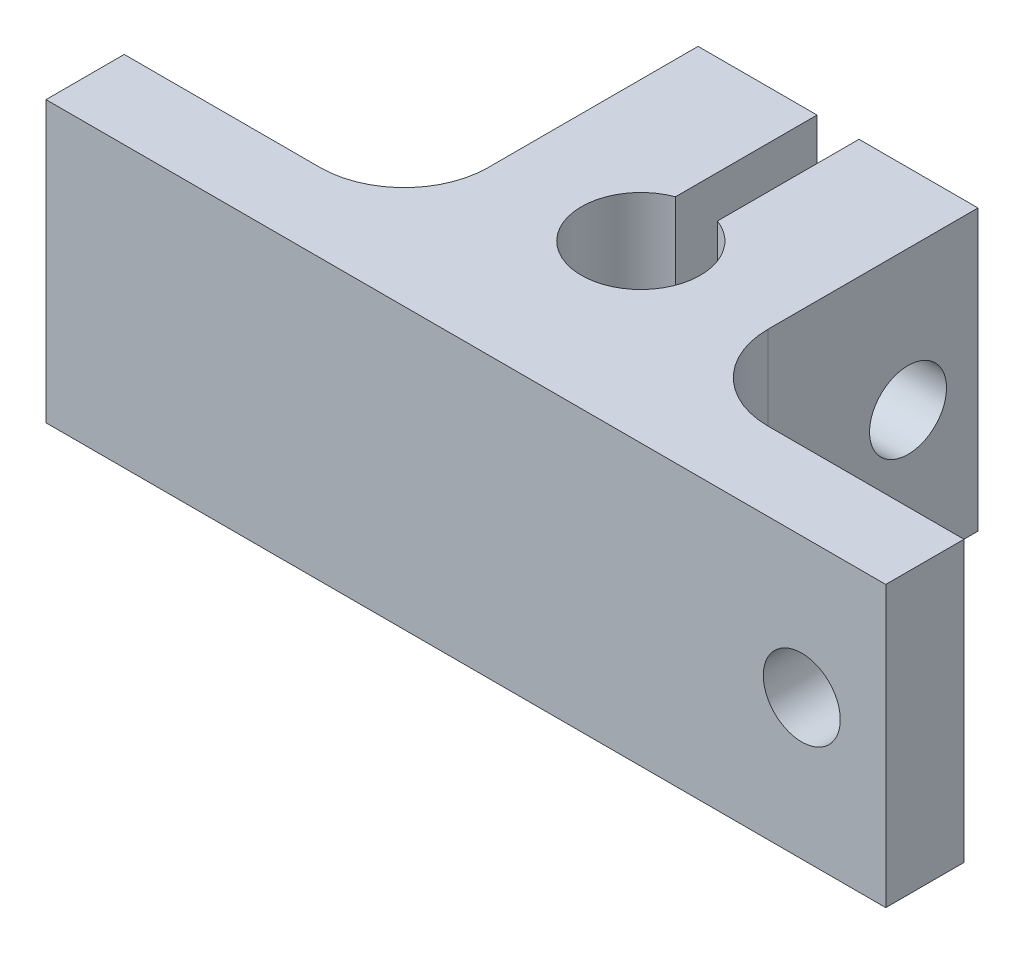
from build123d import *

# Parameters (mm, degrees)
BOSS_EXTRUDE1_DEPTH = 20
SKETCH2_R           = 2.75
CUT_EXTRUDE1_DEPTH  = 42.72529209
SKETCH3_R           = 2.75
CUT_EXTRUDE2_DEPTH  = 47.888574156


with BuildPart() as part:
    # Sketch1 → Boss-Extrude1 (new body)
    with BuildSketch(Plane(origin=(0, 0, 0), x_dir=(1, 0, 0), z_dir=(0, 1, 0))):
        with BuildLine():
            Line((30, -12.5), (-30, -12.5))
            Line((-30, -12.5), (-30, -6.90963498))
            Line((-30, -6.90963498), (-16, -6.90963498))
            ThreePointArc((-16, -6.90963498), (-11.757359313, -5.152275667), (-10, -0.90963498))
            Line((-10, -0.90963498), (-10, 14.09036502))
            Line((-10, 14.09036502), (-1.5, 14.09036502))
            Line((-1.5, 14.09036502), (-1.5, 3.97649343))
            ThreePointArc((-1.5, 3.97649343), (0, -4.25), (1.5, 3.97649343))
            Line((1.5, 3.97649343), (1.5, 14.09036502))
            Line((1.5, 14.09036502), (10, 14.09036502))
            Line((10, 14.09036502), (10, -0.90963498))
            ThreePointArc((10, -0.90963498), (11.757359313, -5.152275667), (16, -6.90963498))
            Line((16, -6.90963498), (30, -6.90963498))
            Line((30, -6.90963498), (30, -12.5))
        make_face()
    extrude(amount=BOSS_EXTRUDE1_DEPTH)

    # Sketch2 → Cut-Extrude1 (cut, through all)
    with BuildSketch(Plane(origin=(0, 0, 6.90963498), x_dir=(-1, 0, 0), z_dir=(0, 0, -1))):
        with Locations((-24, 10)):
            Circle(SKETCH2_R)
        with Locations((35.5, 10)):
            Circle(SKETCH2_R)
    extrude(amount=-CUT_EXTRUDE1_DEPTH, mode=Mode.SUBTRACT)

    # Sketch3 → Cut-Extrude2 (cut, through all)
    with BuildSketch(Plane(origin=(10, 0, 0), x_dir=(0, 0, -1), z_dir=(1, 0, 0))):
        with Locations((9.09036502, 10)):
            Circle(SKETCH3_R)
    extrude(amount=-CUT_EXTRUDE2_DEPTH, mode=Mode.SUBTRACT)


solid = part.part
